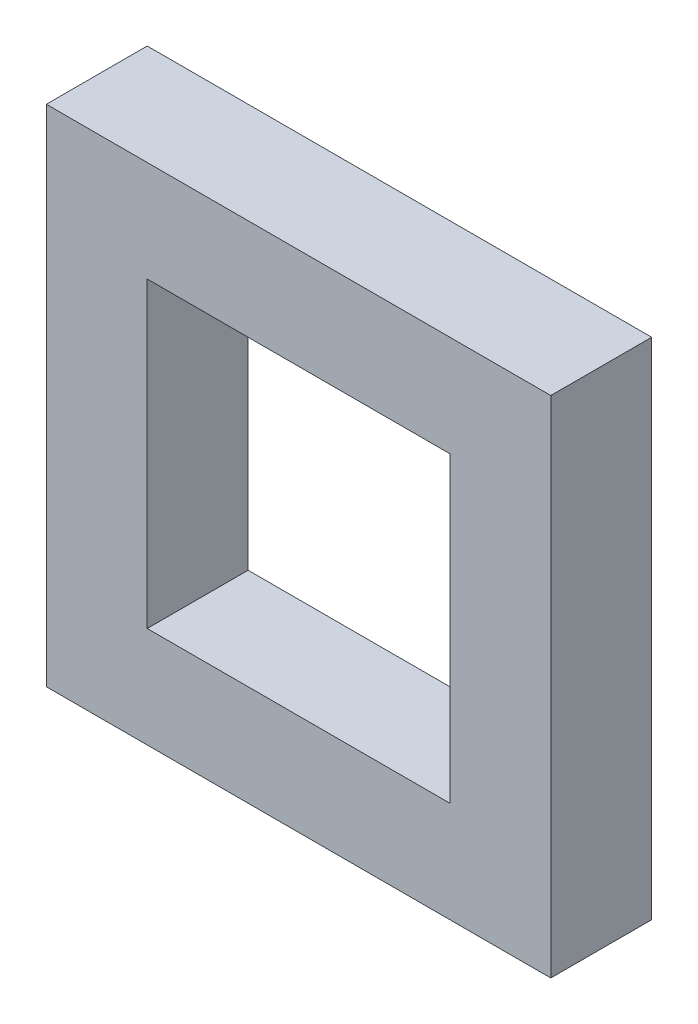
from build123d import *

# Parameters (mm, degrees)
SKETCH1_W           = 31.75
SKETCH1_H           = 31.75
SKETCH1_W_2         = 19.05
SKETCH1_H_2         = 19.05
BOSS_EXTRUDE1_DEPTH = 6.35


with BuildPart() as part:
    # Sketch1 → Boss-Extrude1 (new body)
    with BuildSketch(Plane.XY):
        with Locations((15.875, 15.875)):
            Rectangle(SKETCH1_W, SKETCH1_H)
        with Locations((15.875, 15.875)):
            Rectangle(SKETCH1_W_2, SKETCH1_H_2, mode=Mode.SUBTRACT)
    extrude(amount=BOSS_EXTRUDE1_DEPTH)


solid = part.part
